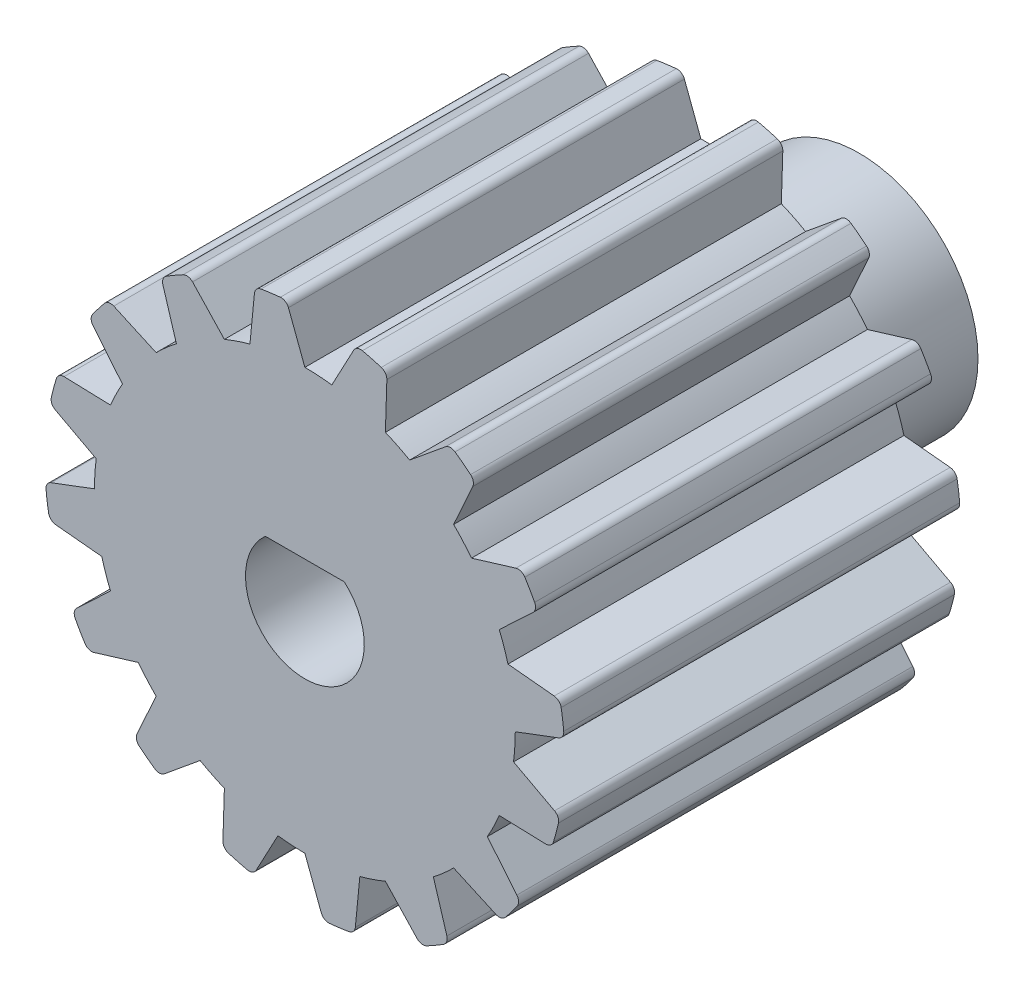
from build123d import *

# Parameters (mm, degrees)
SALIENTE_EXTRUIR1_DEPTH = 15
CROQUIS5_R              = 4.5
SALIENTE_EXTRUIR2_DEPTH = 6
CORTAR_EXTRUIR1_DEPTH   = 26.166810333
ESCALA1_SCALE           = 1.5


with BuildPart() as part:
    # Croquis2 → Saliente-Extruir1 (new body)
    with BuildSketch(Plane.XY):
        with BuildLine():
            Line((-2.081696937, 7.693567449), (-1.911179214, 9.445287663))
            ThreePointArc((-1.911179214, 9.445287663), (-1.831468139, 9.618345927), (-1.663611198, 9.708496165))
            ThreePointArc((-1.663611198, 9.708496165), (-1.297642615, 9.764149919), (-0.929841298, 9.806013214))
            ThreePointArc((-0.929841298, 9.806013214), (-0.744265019, 9.762833784), (-0.622120698, 9.616601835))
            Line((-0.622120698, 9.616601835), (0, 7.97022222))
            ThreePointArc((0, 7.97022222), (0.511536449, 7.953789832), (1.020963606, 7.904560428))
            Line((1.020963606, 7.904560428), (1.848855744, 9.457684572))
            ThreePointArc((1.848855744, 9.457684572), (1.988725705, 9.587065453), (2.1783043, 9.606117341))
            ThreePointArc((2.1783043, 9.606117341), (2.537712953, 9.517484592), (2.893537451, 9.415409764))
            ThreePointArc((2.893537451, 9.415409764), (3.048463524, 9.304500205), (3.105349619, 9.122656892))
            Line((3.105349619, 9.122656892), (3.050071996, 7.363525179))
            ThreePointArc((3.050071996, 7.363525179), (3.516381649, 7.152587108), (3.968191694, 6.912155736))
            Line((3.968191694, 6.912155736), (5.327419174, 8.030234739))
            ThreePointArc((5.327419174, 8.030234739), (5.506154088, 8.09624117), (5.688592714, 8.041294232))
            ThreePointArc((5.688592714, 8.041294232), (5.986724728, 7.821868513), (6.276401353, 7.591395527))
            ThreePointArc((6.276401353, 7.591395527), (6.37709113, 7.429640815), (6.360058606, 7.239870134))
            Line((6.360058606, 7.239870134), (5.635798179, 5.635798179))
            ThreePointArc((5.635798179, 5.635798179), (5.985889619, 5.262467835), (6.311298569, 4.867437992))
            Line((6.311298569, 4.867437992), (7.994931329, 5.380254461))
            ThreePointArc((7.994931329, 5.380254461), (8.185320425, 5.372837562), (8.332844455, 5.252256971))
            ThreePointArc((8.332844455, 5.252256971), (8.524311933, 4.935443857), (8.703740045, 4.611660138))
            ThreePointArc((8.703740045, 4.611660138), (8.73486442, 4.42368596), (8.646506324, 4.254878777))
            Line((8.646506324, 4.254878777), (7.363525179, 3.050071996))
            ThreePointArc((7.363525179, 3.050071996), (7.544100156, 2.571185538), (7.693567449, 2.081696937))
            Line((7.693567449, 2.081696937), (9.445287663, 1.911179214))
            ThreePointArc((9.445287663, 1.911179214), (9.618345927, 1.831468139), (9.708496165, 1.663611198))
            ThreePointArc((9.708496165, 1.663611198), (9.764149919, 1.297642615), (9.806013214, 0.929841298))
            ThreePointArc((9.806013214, 0.929841298), (9.762833784, 0.744265019), (9.616601835, 0.622120698))
            Line((9.616601835, 0.622120698), (7.97022222, 0))
            ThreePointArc((7.97022222, 0), (7.953789832, -0.511536449), (7.904560428, -1.020963606))
            Line((7.904560428, -1.020963606), (9.457684572, -1.848855744))
            ThreePointArc((9.457684572, -1.848855744), (9.587065453, -1.988725705), (9.606117341, -2.1783043))
            ThreePointArc((9.606117341, -2.1783043), (9.517484592, -2.537712953), (9.415409764, -2.893537451))
            ThreePointArc((9.415409764, -2.893537451), (9.304500205, -3.048463524), (9.122656892, -3.105349619))
            Line((9.122656892, -3.105349619), (7.363525179, -3.050071996))
            ThreePointArc((7.363525179, -3.050071996), (7.152587108, -3.516381649), (6.912155736, -3.968191694))
            Line((6.912155736, -3.968191694), (8.030234739, -5.327419174))
            ThreePointArc((8.030234739, -5.327419174), (8.09624117, -5.506154088), (8.041294232, -5.688592714))
            ThreePointArc((8.041294232, -5.688592714), (7.821868513, -5.986724728), (7.591395527, -6.276401353))
            ThreePointArc((7.591395527, -6.276401353), (7.429640815, -6.37709113), (7.239870134, -6.360058606))
            Line((7.239870134, -6.360058606), (5.635798179, -5.635798179))
            ThreePointArc((5.635798179, -5.635798179), (5.262467835, -5.985889619), (4.867437992, -6.311298569))
            Line((4.867437992, -6.311298569), (5.380254461, -7.994931329))
            ThreePointArc((5.380254461, -7.994931329), (5.372837562, -8.185320425), (5.252256971, -8.332844455))
            ThreePointArc((5.252256971, -8.332844455), (4.935443857, -8.524311933), (4.611660138, -8.703740045))
            ThreePointArc((4.611660138, -8.703740045), (4.42368596, -8.73486442), (4.254878777, -8.646506324))
            Line((4.254878777, -8.646506324), (3.050071996, -7.363525179))
            ThreePointArc((3.050071996, -7.363525179), (2.571185538, -7.544100156), (2.081696937, -7.693567449))
            Line((2.081696937, -7.693567449), (1.911179214, -9.445287663))
            ThreePointArc((1.911179214, -9.445287663), (1.831468139, -9.618345927), (1.663611198, -9.708496165))
            ThreePointArc((1.663611198, -9.708496165), (1.297642615, -9.764149919), (0.929841298, -9.806013214))
            ThreePointArc((0.929841298, -9.806013214), (0.744265019, -9.762833784), (0.622120698, -9.616601835))
            Line((0.622120698, -9.616601835), (0, -7.97022222))
            ThreePointArc((0, -7.97022222), (-0.511536449, -7.953789832), (-1.020963606, -7.904560428))
            Line((-1.020963606, -7.904560428), (-1.848855744, -9.457684572))
            ThreePointArc((-1.848855744, -9.457684572), (-1.988725705, -9.587065453), (-2.1783043, -9.606117341))
            ThreePointArc((-2.1783043, -9.606117341), (-2.537712953, -9.517484592), (-2.893537451, -9.415409764))
            ThreePointArc((-2.893537451, -9.415409764), (-3.048463524, -9.304500205), (-3.105349619, -9.122656892))
            Line((-3.105349619, -9.122656892), (-3.050071996, -7.363525179))
            ThreePointArc((-3.050071996, -7.363525179), (-3.516381649, -7.152587108), (-3.968191694, -6.912155736))
            Line((-3.968191694, -6.912155736), (-5.327419174, -8.030234739))
            ThreePointArc((-5.327419174, -8.030234739), (-5.506154088, -8.09624117), (-5.688592714, -8.041294232))
            ThreePointArc((-5.688592714, -8.041294232), (-5.986724728, -7.821868513), (-6.276401353, -7.591395527))
            ThreePointArc((-6.276401353, -7.591395527), (-6.37709113, -7.429640815), (-6.360058606, -7.239870134))
            Line((-6.360058606, -7.239870134), (-5.635798179, -5.635798179))
            ThreePointArc((-5.635798179, -5.635798179), (-5.985889619, -5.262467835), (-6.311298569, -4.867437992))
            Line((-6.311298569, -4.867437992), (-7.994931329, -5.380254461))
            ThreePointArc((-7.994931329, -5.380254461), (-8.185320425, -5.372837562), (-8.332844455, -5.252256971))
            ThreePointArc((-8.332844455, -5.252256971), (-8.524311933, -4.935443857), (-8.703740045, -4.611660138))
            ThreePointArc((-8.703740045, -4.611660138), (-8.73486442, -4.42368596), (-8.646506324, -4.254878777))
            Line((-8.646506324, -4.254878777), (-7.363525179, -3.050071996))
            ThreePointArc((-7.363525179, -3.050071996), (-7.544100156, -2.571185538), (-7.693567449, -2.081696937))
            Line((-7.693567449, -2.081696937), (-9.445287663, -1.911179214))
            ThreePointArc((-9.445287663, -1.911179214), (-9.618345927, -1.831468139), (-9.708496165, -1.663611198))
            ThreePointArc((-9.708496165, -1.663611198), (-9.764149919, -1.297642615), (-9.806013214, -0.929841298))
            ThreePointArc((-9.806013214, -0.929841298), (-9.762833784, -0.744265019), (-9.616601835, -0.622120698))
            Line((-9.616601835, -0.622120698), (-7.97022222, 0))
            ThreePointArc((-7.97022222, 0), (-7.953789832, 0.511536449), (-7.904560428, 1.020963606))
            Line((-7.904560428, 1.020963606), (-9.457684572, 1.848855744))
            ThreePointArc((-9.457684572, 1.848855744), (-9.587065453, 1.988725705), (-9.606117341, 2.1783043))
            ThreePointArc((-9.606117341, 2.1783043), (-9.517484592, 2.537712953), (-9.415409764, 2.893537451))
            ThreePointArc((-9.415409764, 2.893537451), (-9.304500205, 3.048463524), (-9.122656892, 3.105349619))
            Line((-9.122656892, 3.105349619), (-7.363525179, 3.050071996))
            ThreePointArc((-7.363525179, 3.050071996), (-7.152587108, 3.516381649), (-6.912155736, 3.968191694))
            Line((-6.912155736, 3.968191694), (-8.030234739, 5.327419174))
            ThreePointArc((-8.030234739, 5.327419174), (-8.09624117, 5.506154088), (-8.041294232, 5.688592714))
            ThreePointArc((-8.041294232, 5.688592714), (-7.821868513, 5.986724728), (-7.591395527, 6.276401353))
            ThreePointArc((-7.591395527, 6.276401353), (-7.429640815, 6.37709113), (-7.239870134, 6.360058606))
            Line((-7.239870134, 6.360058606), (-5.635798179, 5.635798179))
            ThreePointArc((-5.635798179, 5.635798179), (-5.262467835, 5.985889619), (-4.867437992, 6.311298569))
            Line((-4.867437992, 6.311298569), (-5.380254461, 7.994931329))
            ThreePointArc((-5.380254461, 7.994931329), (-5.372837562, 8.185320425), (-5.252256971, 8.332844455))
            ThreePointArc((-5.252256971, 8.332844455), (-4.935443857, 8.524311933), (-4.611660138, 8.703740045))
            ThreePointArc((-4.611660138, 8.703740045), (-4.42368596, 8.73486442), (-4.254878777, 8.646506324))
            Line((-4.254878777, 8.646506324), (-3.050071996, 7.363525179))
            ThreePointArc((-3.050071996, 7.363525179), (-2.571185538, 7.544100156), (-2.081696937, 7.693567449))
        make_face()
    extrude(amount=SALIENTE_EXTRUIR1_DEPTH)

    # Croquis5 → Saliente-Extruir2 (add)
    with BuildSketch(Plane(origin=(0, 0, 0), x_dir=(-1, 0, 0), z_dir=(0, 0, -1))):
        Circle(CROQUIS5_R)
    extrude(amount=SALIENTE_EXTRUIR2_DEPTH)

    # Croquis3 → Cortar-Extruir1 (cut, through all)
    with BuildSketch(Plane.XY.offset(15)):
        with BuildLine():
            Line((-1.496696362, 1.68), (1.496696362, 1.68))
            ThreePointArc((1.496696362, 1.68), (0, -2.25), (-1.496696362, 1.68))
        make_face()
    extrude(amount=-CORTAR_EXTRUIR1_DEPTH, mode=Mode.SUBTRACT)


with BuildPart() as part_1:
    # Escala1: scaled about (0, 0, 0)
    add(part.part.scale(ESCALA1_SCALE))


solid = part_1.part
